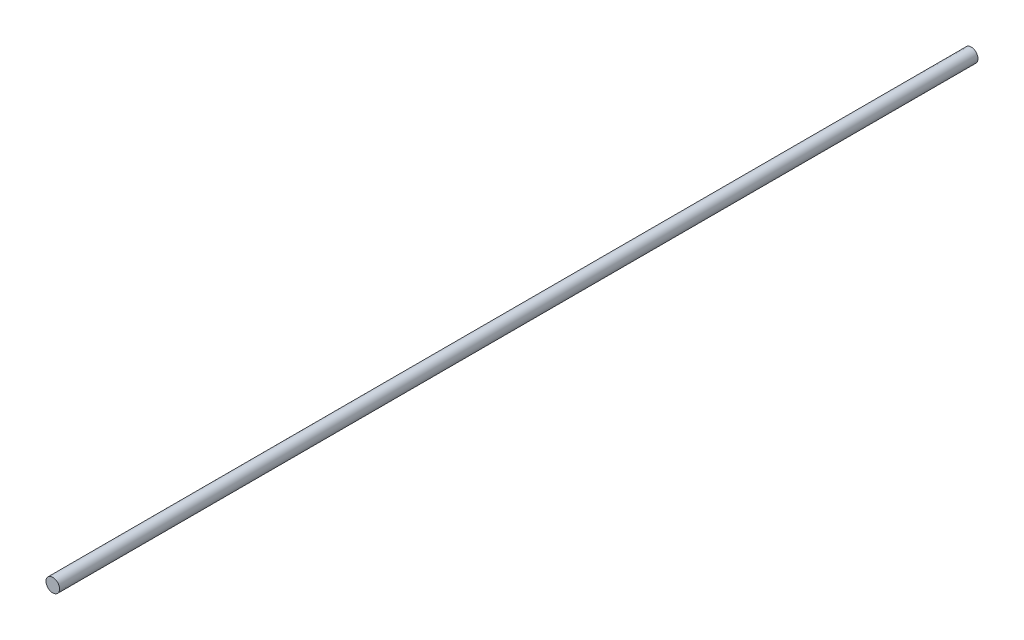
from build123d import *

# Parameters (mm, degrees)
ESQUISSE1_R        = 2.105
BOSS_EXTRU_1_DEPTH = 285


with BuildPart() as part:
    # Esquisse1 → Boss.-Extru.1 (new body)
    with BuildSketch(Plane.XY):
        Circle(ESQUISSE1_R)
    extrude(amount=BOSS_EXTRU_1_DEPTH)


solid = part.part
